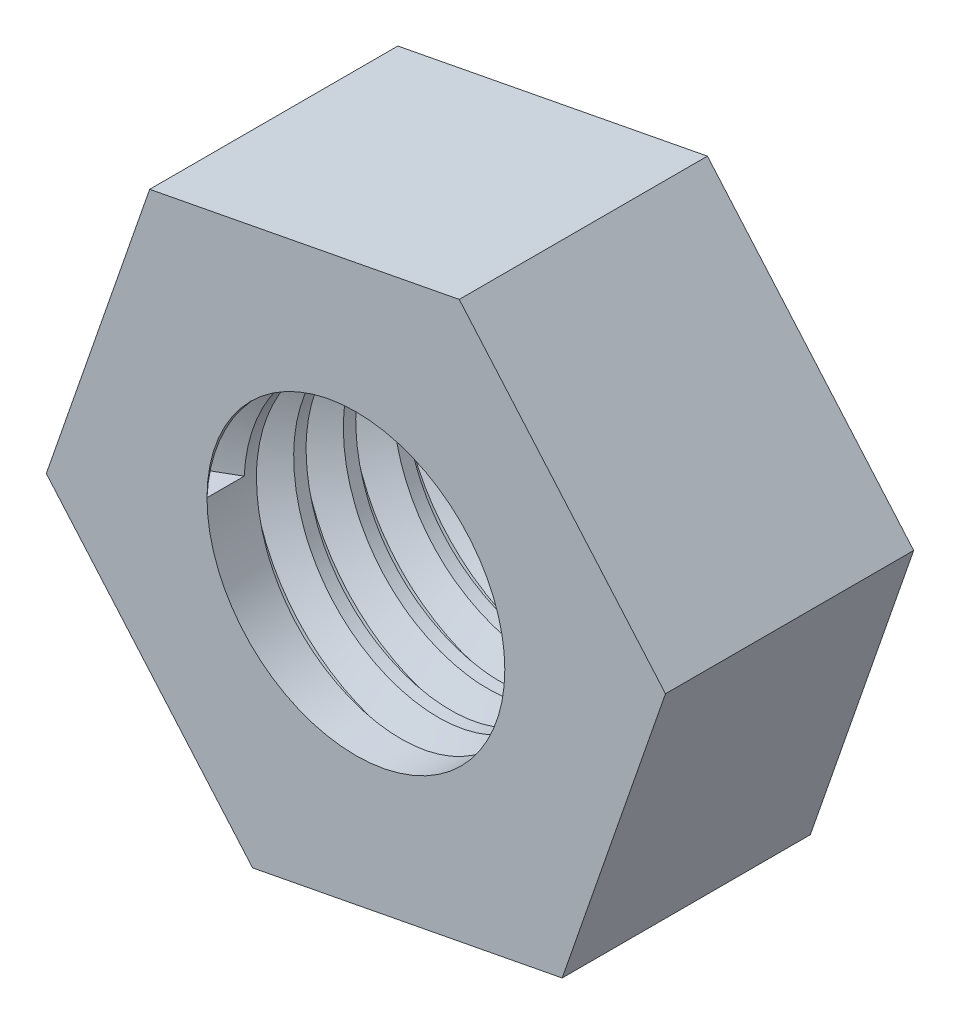
from build123d import *

# Parameters (mm, degrees)
BOSS_EXTRUDE1_DEPTH = 2.5
SKETCH2_R           = 1.5
CUT_EXTRUDE1_DEPTH  = 5.997499054
THREAD1_PITCH       = 0.5


with BuildPart() as part:
    # Sketch1 → Boss-Extrude1 (new body)
    with BuildSketch(Plane.XY):
        Polygon((2.077659711, -2.401387819), (3.118492711, 0.598612181), (1.040833, 3), (-2.077659711, 2.401387819), (-3.118492711, -0.598612181), (-1.040833, -3), align=None)
    extrude(amount=BOSS_EXTRUDE1_DEPTH)

    # Sketch2 → Cut-Extrude1 (cut, through all)
    with BuildSketch(Plane.XY.offset(2.5)):
        Circle(SKETCH2_R)
    extrude(amount=-CUT_EXTRUDE1_DEPTH, mode=Mode.SUBTRACT)

    # Thread1: the profile of Thread Profile1 profile screwed along a right-hand helix of 5 turns, 6 arcs to a turn; built about Z, then put on its axis
    thread1_z = Axis((0, 0, 0), (0, 0, 1))
    thread1_corners = [(1.4997, 0, -0.000173205), (1.770632938, 0, 0.156249999), (1.770632938, 0, 0.218749999), (1.4997, 0, 0.375173204)]
    with BuildLine(mode=Mode.PRIVATE) as thread1_profile:
        Line(thread1_corners[0], thread1_corners[1])
        Line(thread1_corners[1], thread1_corners[2])
        Line(thread1_corners[2], thread1_corners[3])
        Line(thread1_corners[3], thread1_corners[0])
    thread1_cap = Face(thread1_profile.wire())
    thread1_turn_angles = [0, 30, 60, 90, 120, 150, 180, 210, 240, 270, 300, 330, 360]
    thread1_turn_weights = [1, 0.8660254037844387, 1, 0.8660254037844387, 1, 0.8660254037844387, 1, 0.8660254037844387, 1, 0.8660254037844387, 1, 0.8660254037844387, 1]
    thread1_turn_rails = [Edge.make_bspline([Vector(p[0], p[1], 0).rotate(thread1_z, thread1_turn_angles[k]) / thread1_turn_weights[k] + Vector(0, 0, p[2] + THREAD1_PITCH * thread1_turn_angles[k] / 360) for k in range(13)], [0, 0, 0, 1, 1, 2, 2, 3, 3, 4, 4, 5, 5, 6, 6, 6], 2, thread1_turn_weights) for p in thread1_corners]
    thread1_turn_sides = [Face.make_surface_from_curves(thread1_turn_rails[p[0]], thread1_turn_rails[p[1]]) for p in [(0, 1), (1, 2), (2, 3), (3, 0)]]
    thread1 = Plane(origin=(0, 0, 2.5), x_dir=(-1, 0, 0), z_dir=(0, 0, -1)) * Solid(Shell([*[p.moved(Location((0, 0, THREAD1_PITCH * i))) for i in range(5) for p in thread1_turn_sides], thread1_cap, thread1_cap.rotate(thread1_z, 1800).moved(Location((0, 0, THREAD1_PITCH * 1800 / 360)))]))
    add(thread1, mode=Mode.SUBTRACT)


solid = part.part
